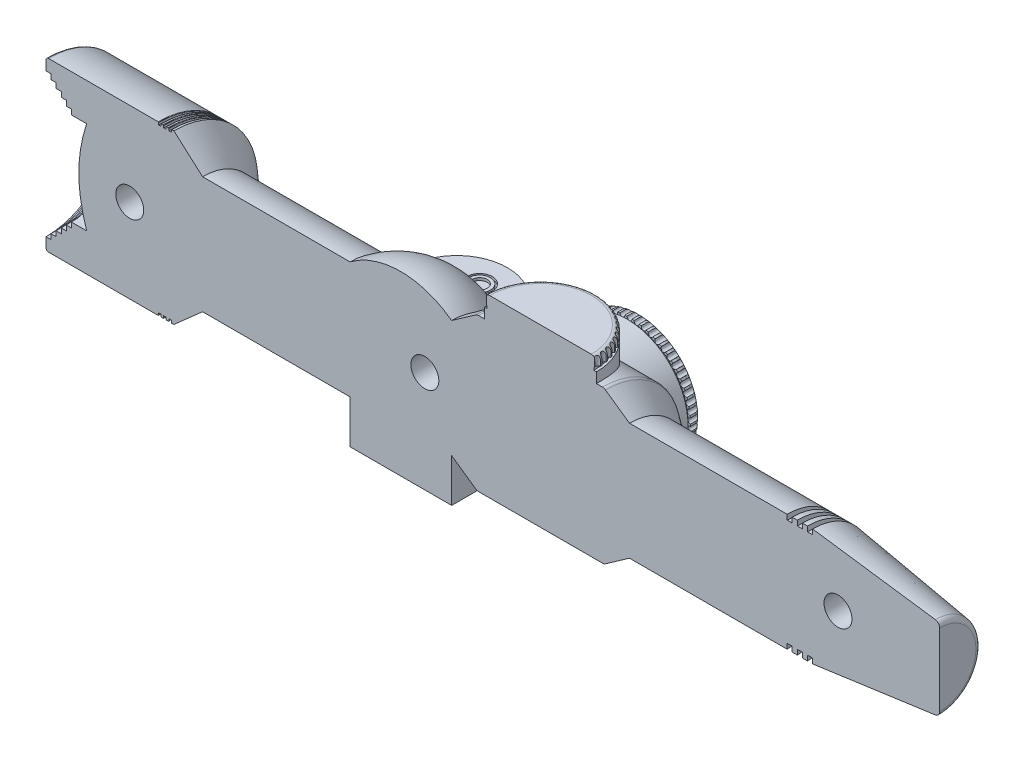
from build123d import *

# Parameters (mm, degrees)
SKETCH1_R                = 16.5
BOSS_EXTRUDE1_DEPTH      = 25.15
SKETCH2_R                = 14.125
CUT_EXTRUDE1_DEPTH       = 1
SKETCH3_R                = 13.125
CUT_EXTRUDE6_DEPTH       = 1
SKETCH14_R               = 12.125
CUT_EXTRUDE7_DEPTH       = 1
SKETCH15_R               = 11.125000000000002
CUT_EXTRUDE8_DEPTH       = 1
SKETCH16_R               = 10.125
CUT_EXTRUDE9_DEPTH       = 1
SKETCH17_R               = 9.125
CUT_EXTRUDE10_DEPTH      = 3
SKETCH21_R               = 11.500000000000002
SHAFT_DEPTH              = 120
SKETCH25_W               = 0.5
SKETCH25_H               = 0.5
FILLET1_R                = 0.1
FILLET2_R                = 0.5
SKETCH27_W               = 1
SKETCH27_H               = 1
SKETCH27_H_2             = 0.9999999999999982
BOSS_EXTRUDE2_DEPTH      = 5
BOSS_EXTRUDE2_DEPTH_BACK = 20
SKETCH29_R               = 2.750000000000008
CUT_EXTRUDE11_DEPTH      = 10
REVOLVE7_ANGLE           = 180.0000000000004
CUT_EXTRUDE12_START      = -0.5
SKETCH31_R               = 2.4999999999999956
CUT_EXTRUDE12_DEPTH      = 10.5
SKETCH32_R               = 2.125000000000003
SKETCH32_R_2             = 1.4999999999999973
BOSS_EXTRUDE3_DEPTH      = 0.5
SKETCH34_R               = 11.99999999999999
BOSS_EXTRUDE4_DEPTH      = 19.5
FILLET3_R                = 1
SKETCH36_W               = 0.5
SKETCH36_H               = 0.5
CUT_EXTRUDE13_REACH      = 183.51
SKETCH39_R               = 0.49999999999999917
CIRPATTERN1_COUNT        = 53
SKETCH40_R               = 10.999999999999993
BOSS_EXTRUDE5_DEPTH      = 19.5
SKETCH41_R               = 5.000000000000004
BOSS_EXTRUDE6_DEPTH      = 19.5
FILLET4_R                = 1
SKETCH43_W               = 0.5
SKETCH43_H               = 0.5
FILLET5_R                = 1
CUT_EXTRUDE14_REACH      = 183.403
SKETCH44_R               = 0.49999999999999917
CIRPATTERN2_COUNT        = 53
SKETCH45_W               = 199.76180513447588
SKETCH45_H               = 54.821107430784096
CUT_EXTRUDE15_DEPTH      = 179.1758682969161
SKETCH46_R               = 2.750000000000008
SKETCH46_R_2             = 2.7499999999999982
CUT_EXTRUDE17_DEPTH      = 5


with BuildPart() as part:
    # Sketch1 → Boss-Extrude1 (new body)
    with BuildSketch(Plane(origin=(0, 0, 0), x_dir=(0, 0, -1), z_dir=(1, 0, 0))):
        Circle(SKETCH1_R)
    extrude(amount=BOSS_EXTRUDE1_DEPTH)

    # Sketch2 → Cut-Extrude1 (cut)
    with BuildSketch(Plane.ZY):
        Circle(SKETCH2_R)
    extrude(amount=-CUT_EXTRUDE1_DEPTH, mode=Mode.SUBTRACT)

    # Sketch3 → Cut-Extrude6 (cut)
    with BuildSketch(Plane.ZY.offset(-1)):
        Circle(SKETCH3_R)
    extrude(amount=-CUT_EXTRUDE6_DEPTH, mode=Mode.SUBTRACT)

    # Sketch14 → Cut-Extrude7 (cut)
    with BuildSketch(Plane.ZY.offset(-2)):
        Circle(SKETCH14_R)
    extrude(amount=-CUT_EXTRUDE7_DEPTH, mode=Mode.SUBTRACT)

    # Sketch15 → Cut-Extrude8 (cut)
    with BuildSketch(Plane.ZY.offset(-3)):
        Circle(SKETCH15_R)
    extrude(amount=-CUT_EXTRUDE8_DEPTH, mode=Mode.SUBTRACT)

    # Sketch16 → Cut-Extrude9 (cut)
    with BuildSketch(Plane.ZY.offset(-4)):
        Circle(SKETCH16_R)
    extrude(amount=-CUT_EXTRUDE9_DEPTH, mode=Mode.SUBTRACT)

    # Sketch17 → Cut-Extrude10 (cut)
    with BuildSketch(Plane.ZY.offset(-5)):
        Circle(SKETCH17_R)
    extrude(amount=-CUT_EXTRUDE10_DEPTH, mode=Mode.SUBTRACT)

    # Sketch18 → Revolve1 (revolve)
    with BuildSketch(Plane(origin=(0, 0, 0), x_dir=(1, 0, 0), z_dir=(0, 1, 0))):
        with BuildLine():
            Line((6.467108158178063, 0), (8, 0))
            Line((8, 0), (8, 9.125))
            add(Edge.make_bspline(
                [(8, 9.125), (6.467108158178799, 4.562499999997817), (6.467108158178063, 0)],
                knots=[0, 0, 0, 0.49999999999976064, 0.49999999999976064, 0.49999999999976064], degree=2))
        make_face()
    revolve(axis=Axis((25.15, 0, 0), (-1, 0, 0)))

    # Sketch20 → Revolve5 (revolve)
    with BuildSketch(Plane(origin=(0, 0, 0), x_dir=(1, 0, 0), z_dir=(0, 1, 0))):
        Polygon((25.15, 16.5), (25.15, 0), (30.8, 0), (30.8, 11.5), align=None)
    revolve(axis=Axis((25.15, 0, 0), (1, 0, 0)))

    # Sketch21 → Shaft (add)
    with BuildSketch(Plane(origin=(30.8, 0, 0), x_dir=(0, 0, -1), z_dir=(1, 0, 0))):
        Circle(SKETCH21_R)
    extrude(amount=SHAFT_DEPTH)

    # Sketch25 → Cut-Revolve13 (revolve, cut)
    with BuildSketch(Plane(origin=(0, 0, 0), x_dir=(1, 0, 0), z_dir=(0, 1, 0))):
        with Locations((23.399999999999995, 16.25)):
            Rectangle(SKETCH25_W, SKETCH25_H)
        with Locations((24.399999999999995, 16.25)):
            Rectangle(SKETCH25_W, SKETCH25_H)
        with Locations((22.399999999999995, 16.25)):
            Rectangle(SKETCH25_W, SKETCH25_H)
    revolve(axis=Axis((25.15, 0, 0), (-1, 0, 0)), mode=Mode.SUBTRACT)

    # Fillet1
    fillet1_edges = [part.edges().sort_by_distance(p)[0] for p in [
        (24.65, -2.02e-15, 16.5),
        (24.15, -2.02e-15, 16.5),
        (23.65, -2.02e-15, 16.5),
        (23.15, -2.02e-15, 16.5),
        (22.649999999999995, -2.02e-15, 16.5),
        (22.149999999999995, -2.02e-15, 16.5),
    ]]
    fillet(fillet1_edges, radius=FILLET1_R)

    # Fillet2
    fillet2_edges = [part.edges().sort_by_distance(p)[0] for p in [
        (0, 2.02e-15, 16.5),
    ]]
    fillet(fillet2_edges, radius=FILLET2_R)

    # Sketch26 → Revolve6 (revolve)
    with BuildSketch(Plane(origin=(0, 0, 0), x_dir=(1, 0, 0), z_dir=(0, 1, 0))):
        with BuildLine():
            Line((150.79999999999998, -11.500000000000002), (150.79999999999998, 0))
            Line((150.79999999999998, 0), (175.79999999999998, 0))
            Line((175.79999999999998, 0), (175.79999999999998, -7.130247555090847))
            ThreePointArc((175.79999999999998, -7.130247555090847), (175.5545355672645, -7.7865067094900855), (174.9386478445344, -8.120589301765184))
            Line((174.9386478445344, -8.120589301765184), (150.79999999999998, -11.500000000000002))
        make_face()
    revolve(axis=Axis((150.79999999999998, 0, 0), (-1, 0, 0)))

    # Sketch27 → Cut-Revolve14 (revolve, cut)
    with BuildSketch(Plane(origin=(0, 0, 0), x_dir=(1, 0, 0), z_dir=(0, 1, 0))):
        with Locations((148.29999999999998, -11.000000000000016)):
            Rectangle(SKETCH27_W, SKETCH27_H)
        with Locations((150.29999999999998, -11.000000000000002)):
            Rectangle(SKETCH27_W, SKETCH27_H)
        with Locations((146.29999999999998, -11.000000000000028)):
            Rectangle(SKETCH27_W, SKETCH27_H_2)
    revolve(axis=Axis((150.79999999999998, 0, 0), (-1, 0, 0)), mode=Mode.SUBTRACT)

    # Sketch28 → Boss-Extrude2 (add, two sides: drawn at the far end of the back side and taken through both)
    with BuildSketch(Plane(origin=(0, 0, 0), x_dir=(1, 0, 0), z_dir=(0, 1, 0)).offset(-BOSS_EXTRUDE2_DEPTH_BACK)):
        with BuildLine():
            Line((59.800000000000004, 11.000000000000016), (59.800000000000004, -10.999999999999984))
            ThreePointArc((59.800000000000004, -10.999999999999984), (69.8, -20.999999999999975), (79.8, -10.999999999999982))
            Line((79.8, -10.999999999999982), (79.8, 11.000000000000018))
            ThreePointArc((79.8, 11.000000000000018), (69.8, 21.000000000000014), (59.800000000000004, 11.000000000000016))
        make_face()
    extrude(amount=BOSS_EXTRUDE2_DEPTH + BOSS_EXTRUDE2_DEPTH_BACK)

    # Sketch29 → Cut-Extrude11 (cut)
    with BuildSketch(Plane.XZ.offset(20)):
        with Locations((69.8, -11.000000000000016)):
            Circle(SKETCH29_R)
        with Locations((69.8, 6.999999999999981)):
            Circle(SKETCH29_R)
    extrude(amount=-CUT_EXTRUDE11_DEPTH, mode=Mode.SUBTRACT)

    # Sketch30 → Revolve7 (revolve)
    with BuildSketch(Plane(origin=(0, 0, 0), x_dir=(1, 0, 0), z_dir=(0, 1, 0))):
        with BuildLine():
            Line((59.81250782228093, 11.500000000000002), (79.78749217771909, 11.500000000000002))
            ThreePointArc((79.78749217771909, 11.500000000000002), (69.80000000000001, 14.856157588603978), (59.81250782228093, 11.500000000000002))
        make_face()
    revolve(axis=Axis((150.79999999999998, 0, 0), (1, 0, 0)), revolution_arc=REVOLVE7_ANGLE)

    # Sketch31 → Cut-Extrude12 (cut)
    with BuildSketch(Plane(origin=(0, 5, 0), x_dir=(1, 0, 0), z_dir=(0, 1, 0)).offset(CUT_EXTRUDE12_START)):
        with Locations((69.8, 15.50000000000001)):
            Circle(SKETCH31_R)
    cut_extrude12 = extrude(amount=CUT_EXTRUDE12_DEPTH, mode=Mode.SUBTRACT)

    # Sketch32 → Boss-Extrude3 (add)
    with BuildSketch(Plane(origin=(0, 4.500000000000001, 0), x_dir=(1, 0, 0), z_dir=(0, 1, 0))):
        with Locations((69.8, 15.50000000000001)):
            Circle(SKETCH32_R)
        with Locations((69.8, 15.50000000000001)):
            Circle(SKETCH32_R_2, mode=Mode.SUBTRACT)
    boss_extrude3 = extrude(amount=BOSS_EXTRUDE3_DEPTH)

    # Mirror2: Cut-Extrude12, Boss-Extrude3 across plane
    add(cut_extrude12.mirror(Plane.XY), mode=Mode.SUBTRACT)
    add(boss_extrude3.mirror(Plane.XY))

    # Sketch33 → Revolve8 (revolve)
    with BuildSketch(Plane(origin=(0, 0, 0), x_dir=(1, 0, 0), z_dir=(0, 1, 0))):
        with BuildLine():
            Line((79.78749217771909, 11.500000000000002), (84.52925206417486, 14.819231920519037))
            ThreePointArc((84.52925206417486, 14.819231920519037), (84.8020750236591, 14.953737888656791), (85.1027144085382, 15))
            Line((85.1027144085382, 15), (109.4722699469, 15))
            ThreePointArc((109.4722699469, 15), (109.77290933177909, 14.953737888656795), (110.04573229126333, 14.819231920519037))
            Line((110.04573229126333, 14.819231920519037), (114.7874921777191, 11.500000000000002))
            Line((114.7874921777191, 11.500000000000002), (79.78749217771909, 11.500000000000002))
        make_face()
    revolve(axis=Axis((150.79999999999998, 0, 0), (-1, 0, 0)))

    # Sketch34 → Boss-Extrude4 (add)
    with BuildSketch(Plane.XY):
        with Locations((97.2874921777191, 0)):
            Circle(SKETCH34_R)
    extrude(amount=-BOSS_EXTRUDE4_DEPTH)

    # Fillet3
    fillet3_edges = [part.edges().sort_by_distance(p)[0] for p in [
        (85.28749217771912, 1.47e-15, -19.5),
    ]]
    fillet(fillet3_edges, radius=FILLET3_R)

    # Sketch36 → Cut-Revolve15 (revolve, cut)
    with BuildSketch(Plane(origin=(0, 0, 0), x_dir=(1, 0, 0), z_dir=(0, 1, 0))):
        with Locations((85.53749217771912, 17.249999999999996)):
            Rectangle(SKETCH36_W, SKETCH36_H)
    revolve(axis=Axis((97.2874921777191, 0, -19.5), (0, 0, 1)), mode=Mode.SUBTRACT)

    # Sketch39 → Cut-Extrude13 (cut, up to next)
    with BuildSketch(Plane(origin=(0, 0, -19.5), x_dir=(-1, 0, 0), z_dir=(0, 0, -1)), mode=Mode.PRIVATE) as cut_extrude13_sk1:
        with Locations((-97.2874921777191, 11.999999999999996)):
            Circle(SKETCH39_R)
    cut_extrude13_tool1 = extrude(cut_extrude13_sk1.sketch, amount=-CUT_EXTRUDE13_REACH, mode=Mode.PRIVATE) & part.part
    cut_extrude13 = cut_extrude13_tool1.solids().sort_by_distance((97.287492, 12, -19.5))[0]
    add(cut_extrude13, mode=Mode.SUBTRACT)

    # CirPattern1: Cut-Extrude13 ×53 about axis
    cirpattern1_axis = Axis((97.2874921777191, 0, -18.5), (0, 0, 1))
    for i in range(1, CIRPATTERN1_COUNT):
        add(cut_extrude13.rotate(cirpattern1_axis, i * 360 / CIRPATTERN1_COUNT), mode=Mode.SUBTRACT)

    # Sketch40 → Boss-Extrude5 (add)
    with BuildSketch(Plane(origin=(0, 0, 0), x_dir=(1, 0, 0), z_dir=(0, 1, 0))):
        with Locations((97.2874921777191, 0)):
            Circle(SKETCH40_R)
    extrude(amount=BOSS_EXTRUDE5_DEPTH)

    # Sketch41 → Boss-Extrude6 (add)
    with BuildSketch(Plane(origin=(0, 0, 0), x_dir=(-1, 0, 0), z_dir=(0, 0.7071067811865475, -0.7071067811865477))):
        with Locations((-97.2874921777191, 0)):
            Circle(SKETCH41_R)
    extrude(amount=-BOSS_EXTRUDE6_DEPTH)

    # Fillet4
    fillet4_edges = [part.edges().sort_by_distance(p)[0] for p in [
        (102.2874921777191, -13.788582233137676, 13.78858223313768),
    ]]
    fillet(fillet4_edges, radius=FILLET4_R)

    # Sketch43 → Cut-Revolve16 (revolve, cut)
    with BuildSketch(Plane.XY):
        with Locations((108.0374921777191, 17.25)):
            Rectangle(SKETCH43_W, SKETCH43_H)
    revolve(axis=Axis((97.2874921777191, 19.5, 0), (0, -1, 0)), mode=Mode.SUBTRACT)

    # Fillet5
    fillet5_edges = [part.edges().sort_by_distance(p)[0] for p in [
        (86.28749217771912, 19.5, -6.23e-15),
    ]]
    fillet(fillet5_edges, radius=FILLET5_R)

    # Sketch44 → Cut-Extrude14 (cut, up to next)
    with BuildSketch(Plane(origin=(0, 19.5, 0), x_dir=(1, 0, 0), z_dir=(0, 1, 0)), mode=Mode.PRIVATE) as cut_extrude14_sk1:
        with Locations((97.28749217771912, 10.999999999999986)):
            Circle(SKETCH44_R)
    cut_extrude14_tool1 = extrude(cut_extrude14_sk1.sketch, amount=-CUT_EXTRUDE14_REACH, mode=Mode.PRIVATE) & part.part
    cut_extrude14 = cut_extrude14_tool1.solids().sort_by_distance((97.287492, 19.5, -11))[0]
    add(cut_extrude14, mode=Mode.SUBTRACT)

    # CirPattern2: Cut-Extrude14 ×53 about axis
    cirpattern2_axis = Axis((97.2874921777191, 18.5, 0), (0, -1, 0))
    for i in range(1, CIRPATTERN2_COUNT):
        add(cut_extrude14.rotate(cirpattern2_axis, i * 360 / CIRPATTERN2_COUNT), mode=Mode.SUBTRACT)

    # Sketch45 → Cut-Extrude15 (cut, through all)
    with BuildSketch(Plane.XY):
        with Locations((88.51477663496954, 0.04185699517005759)):
            Rectangle(SKETCH45_W, SKETCH45_H)
    extrude(amount=CUT_EXTRUDE15_DEPTH, mode=Mode.SUBTRACT)

    # Sketch46 → Cut-Extrude17 (cut)
    with BuildSketch(Plane.XY):
        with Locations((155.79999999999998, 0)):
            Circle(SKETCH46_R)
        with Locations((16.46710815817806, 0)):
            Circle(SKETCH46_R_2)
        with Locations((74.5243050441502, 0)):
            Circle(SKETCH46_R)
    extrude(amount=-CUT_EXTRUDE17_DEPTH, mode=Mode.SUBTRACT)


solid = part.part
